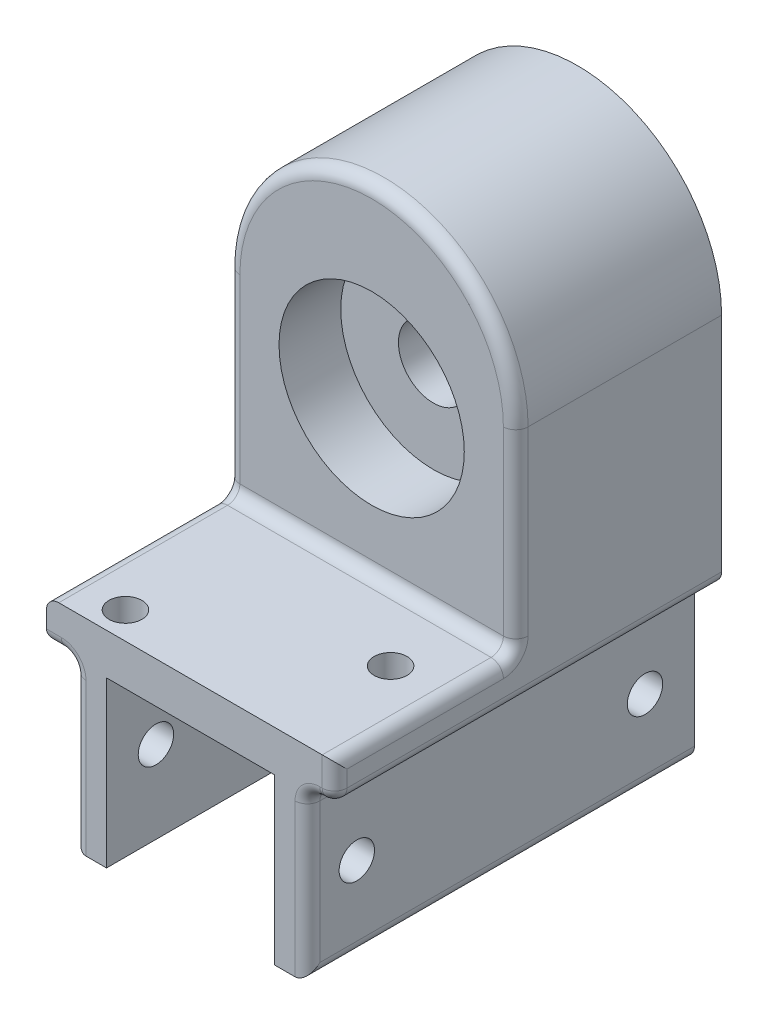
from build123d import *

# Parameters (mm, degrees)
SKETCH1_W           = 35
SKETCH1_H           = 28.5
BOSS_EXTRUDE1_DEPTH = 25
SKETCH2_R           = 4.25
CUT_EXTRUDE1_DEPTH  = 20
SKETCH3_R           = 11.25
CUT_EXTRUDE2_DEPTH  = 7.5
SKETCH9_W           = 35
SKETCH9_H           = 5
BOSS_EXTRUDE4_DEPTH = 22
SKETCH4_W           = 4
SKETCH4_H           = 47
BOSS_EXTRUDE2_DEPTH = 20
FILLET1_R           = 1.5
CUT_EXTRUDE3_REACH  = 66.415
SKETCH6_R           = 2.15
MIRROR1_START       = -14.2
MIRROR1_OUTLINE_W   = 20
MIRROR1_OUTLINE_H   = 47
MIRROR1_OUTLINE_R   = 2.15
MIRROR1_DEPTH       = 4
MIRROR1_2_DEPTH     = 47
FILLET2_R           = 1.5
SKETCH10_R          = 2
CUT_EXTRUDE4_DEPTH  = 4.3


with BuildPart() as part:
    # Sketch1 → Boss-Extrude1 (new body)
    with BuildSketch(Plane.XY):
        with BuildLine():
            ThreePointArc((-17.5, 14.25), (0, 31.75), (17.5, 14.25))
            Line((17.5, 14.25), (-17.5, 14.25))
        make_face()
        Rectangle(SKETCH1_W, SKETCH1_H)
    extrude(amount=BOSS_EXTRUDE1_DEPTH)

    # Sketch2 → Cut-Extrude1 (cut)
    with BuildSketch(Plane.XY.offset(25)):
        with Locations((0, 9.25)):
            Circle(SKETCH2_R)
    extrude(amount=-CUT_EXTRUDE1_DEPTH, mode=Mode.SUBTRACT)

    # Sketch3 → Cut-Extrude2 (cut)
    with BuildSketch(Plane.XY.offset(25)):
        with Locations((0, 9.25)):
            Circle(SKETCH3_R)
    extrude(amount=-CUT_EXTRUDE2_DEPTH, mode=Mode.SUBTRACT)

    # Sketch9 → Boss-Extrude4 (add)
    with BuildSketch(Plane.XY.offset(25)):
        with Locations((0, -11.75)):
            Rectangle(SKETCH9_W, SKETCH9_H)
    extrude(amount=BOSS_EXTRUDE4_DEPTH)

    # Sketch4 → Boss-Extrude2 (add)
    with BuildSketch(Plane.XZ.offset(14.25)):
        with Locations((12.2, 23.5)):
            Rectangle(SKETCH4_W, SKETCH4_H)
    extrude(amount=BOSS_EXTRUDE2_DEPTH)

    # Fillet1
    fillet1_edges = [part.edges().sort_by_distance(p)[0] for p in [
        (14.2, -14.25, 23.5),
        (17.5, -14.25, 23.5),
    ]]
    fillet(fillet1_edges, radius=FILLET1_R)

    # Sketch6 → Cut-Extrude3 (cut, up to next)
    with BuildSketch(Plane.ZY.offset(-10.2), mode=Mode.PRIVATE) as cut_extrude3_sk1:
        with Locations(Location((6, -24.25, 0), (0, 0, 270))):
            Circle(SKETCH6_R)
    cut_extrude3_tool1 = extrude(cut_extrude3_sk1.sketch, amount=-CUT_EXTRUDE3_REACH, mode=Mode.PRIVATE) & part.part
    # Sketch6 → Cut-Extrude3 (cut, up to next)
    with BuildSketch(Plane.ZY.offset(-10.2), mode=Mode.PRIVATE) as cut_extrude3_sk2:
        with Locations(Location((41, -24.25, 0), (0, 0, 270))):
            Circle(SKETCH6_R)
    cut_extrude3_tool2 = extrude(cut_extrude3_sk2.sketch, amount=-CUT_EXTRUDE3_REACH, mode=Mode.PRIVATE) & part.part
    add(cut_extrude3_tool1.solids().sort_by_distance((10.2, -24.25, 6))[0], mode=Mode.SUBTRACT)
    add(cut_extrude3_tool2.solids().sort_by_distance((10.2, -24.25, 41))[0], mode=Mode.SUBTRACT)

    # Mirror1: read off the stored shape, not the designer's step
    # Mirror1 outline → Mirror1 (add)
    with BuildSketch(Plane.YZ.offset(MIRROR1_START)):
        with Locations((-24.25, 23.5)):
            Rectangle(MIRROR1_OUTLINE_W, MIRROR1_OUTLINE_H)
        with Locations((-24.25, 6)):
            Circle(MIRROR1_OUTLINE_R, mode=Mode.SUBTRACT)
        with Locations((-24.25, 41)):
            Circle(MIRROR1_OUTLINE_R, mode=Mode.SUBTRACT)
    extrude(amount=MIRROR1_DEPTH)

    # Mirror1 2 outline → Mirror1 2 (add)
    with BuildSketch(Plane.XY):
        with BuildLine():
            Line((-14.2, -14.25), (-15.7, -14.25))
            ThreePointArc((-15.7, -14.25), (-14.639339828, -14.689339828), (-14.2, -15.75))
            Line((-14.2, -15.75), (-14.2, -14.25))
        make_face()
    extrude(amount=MIRROR1_2_DEPTH)

    # Fillet2
    fillet2_edges = [part.edges().sort_by_distance(p)[0] for p in [
        (-17.5, 2.5, 25),
        (17.5, 2.5, 25),
        (-17.5, -9.25, 36),
        (0, -9.25, 25),
        (17.5, -9.25, 36),
        (-16.6, -14.25, 47),
        (14.2, -25, 47),
        (14.2, -34.25, 23.5),
        (0, 31.75, 25),
        (17.5, -11, 47),
        (15.85, -14.25, 47),
        (17.060660172, -13.810660172, 47),
        (14.639339828, -14.689339828, 47),
        (-14.2, -34.25, 23.5),
        (-14.2, -25, 47),
        (-14.639339828, -14.689339828, 47),
        (-17.5, -14.25, 23.5),
    ]]
    fillet(fillet2_edges, radius=FILLET2_R)

    # Sketch10 → Cut-Extrude4 (cut)
    with BuildSketch(Plane(origin=(0, -9.25, 0), x_dir=(1, 0, 0), z_dir=(0, 1, 0))):
        with Locations(Location((10.8, -33.5, 0), (0, 0, 270))):
            Circle(SKETCH10_R)
        with Locations(Location((-11.2, -43.7, 0), (0, 0, 270))):
            Circle(SKETCH10_R)
    extrude(amount=-CUT_EXTRUDE4_DEPTH, mode=Mode.SUBTRACT)


solid = part.part
